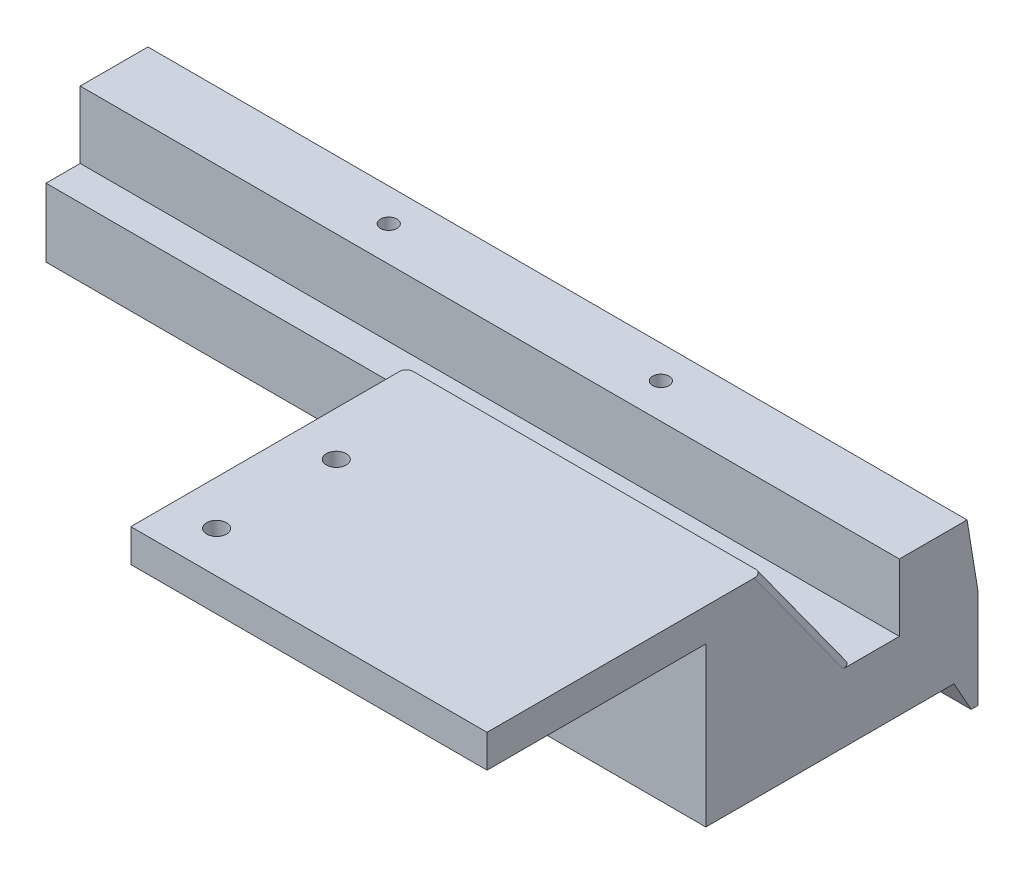
from build123d import *

# Parameters (mm, degrees)
SZKIC1_W                                             = 119.8
SZKIC1_H                                             = 10
DODANIE_WYCI_GNI_CIE2_DEPTH                          = 38.3
SZKIC21_W                                            = 119.8
SZKIC21_H                                            = 10
DODANIE_WYCI_GNI_CIE3_DEPTH                          = 9.8
POG_BIENIE_WALCOWE_POD_M2_WKR_T_DO_CZ_CI_D           = 2.4
POG_BIENIE_WALCOWE_POD_M2_WKR_T_DO_CZ_CI_CBORE_D     = 5
POG_BIENIE_WALCOWE_POD_M2_WKR_T_DO_CZ_CI_CBORE_DEPTH = 1.6
SZKIC28_R                                            = 11.1
WYTNIJ_WYCI_GNI_CIE1_DEPTH                           = 7.2
WYTNIJ_WYCI_GNI_CIE4_DEPTH                           = 124.8
DODANIE_WYCI_GNI_CIE5_DEPTH                          = 119.8
SZKIC34_W                                            = 119.8
SZKIC34_H                                            = 10
DODANIE_WYCI_GNI_CIE6_DEPTH                          = 1.5
SZKIC37_W                                            = 52.1
SZKIC37_H                                            = 8.3
DODANIE_WYCI_GNI_CIE8_DEPTH                          = 18
SZKIC38_W                                            = 52.1
SZKIC38_H                                            = 4.8
DODANIE_WYCI_GNI_CIE11_DEPTH                         = 32
ZAOKR_GLENIE5_R                                      = 0.5
SZYK_LINIOWY2_COUNT                                  = 2
SZYK_LINIOWY2_PITCH                                  = 24.2
ZAOKR_GLENIE5_OF_SZYK_LINIOWY2_R                     = 0.5
OTW_R_POD_RUB_M2_51_D                                = 2.9
EBRO7_REACH                                          = 149.637
SZKIC52_WALL_W                                       = 319.477141382
SZKIC52_WALL_H                                       = 3
ZAOKR_GLENIE7_R                                      = 1
SZYK_LINIOWY6_COUNT                                  = 5
SZYK_LINIOWY6_PITCH                                  = 12.25
ZAOKR_GLENIE7_OF_SZYK_LINIOWY6_R                     = 1
ZAOKR_GLENIE8_R                                      = 1
SZKIC53_W                                            = 67.7
SZKIC53_H                                            = 10
WYTNIJ_WYCI_GNI_CIE5_DEPTH                           = 23.3
DODANIE_WYCI_GNI_CIE12_DEPTH                         = 119.8
SZKIC55_R                                            = 5.1
WYTNIJ_WYCI_GNI_CIE6_DEPTH                           = 4.1


with BuildPart() as part:
    # Szkic1 → Dodanie-wyciągnięcie2 (new body)
    with BuildSketch(Plane.XY):
        with Locations((1.59336777, 27.024849398)):
            Rectangle(SZKIC1_W, SZKIC1_H)
    extrude(amount=DODANIE_WYCI_GNI_CIE2_DEPTH)

    # Szkic21 → Dodanie-wyciągnięcie3 (add)
    with BuildSketch(Plane(origin=(0, 32.024849398, 0), x_dir=(1, 0, 0), z_dir=(0, 1, 0))):
        with Locations((1.59336777, -5)):
            Rectangle(SZKIC21_W, SZKIC21_H)
    extrude(amount=DODANIE_WYCI_GNI_CIE3_DEPTH)

    # Pogłębienie walcowe pod M2 wkręt do części metalowych z łbem stożkowym ściętym2 (through all)
    with Locations(Plane(origin=(0, 22.024849398, 0), x_dir=(-1, 0, 0), z_dir=(0, -1, 0))):
        with Locations((-21.49336777, -4.88), (18.30663223, -4.88)):
            CounterBoreHole(POG_BIENIE_WALCOWE_POD_M2_WKR_T_DO_CZ_CI_D / 2, POG_BIENIE_WALCOWE_POD_M2_WKR_T_DO_CZ_CI_CBORE_D / 2, POG_BIENIE_WALCOWE_POD_M2_WKR_T_DO_CZ_CI_CBORE_DEPTH)

    # Szkic28 → Wytnij-wyciągnięcie1 (cut)
    with BuildSketch(Plane.XZ.offset(-22.024849398)):
        with Locations((36.49336777, 23.3)):
            Circle(SZKIC28_R)
    extrude(amount=-WYTNIJ_WYCI_GNI_CIE1_DEPTH, mode=Mode.SUBTRACT)

    # Szkic31 → Wytnij-wyciągnięcie4 (cut)
    with BuildSketch(Plane(origin=(61.49336777, 0, 0), x_dir=(0, 0, -1), z_dir=(1, 0, 0))):
        Polygon((0, 41.824849398), (-0.096491228, 41.824849398), (0, 41.232541705), align=None)
    extrude(amount=-WYTNIJ_WYCI_GNI_CIE4_DEPTH, mode=Mode.SUBTRACT)

    # Szkic31<5> → Dodanie-wyciągnięcie5 (add)
    with BuildSketch(Plane(origin=(61.49336777, 0, 0), x_dir=(0, 0, -1), z_dir=(1, 0, 0))):
        Polygon((0, 41.232541705), (0, 32.024849398), (1.5, 32.024849398), (0.275236278, 39.543014399), align=None)
    extrude(amount=-DODANIE_WYCI_GNI_CIE5_DEPTH)

    # Szkic34 → Dodanie-wyciągnięcie6 (add)
    with BuildSketch(Plane(origin=(0, 0, 0), x_dir=(-1, 0, 0), z_dir=(0, 0, -1))):
        with Locations((-1.59336777, 27.024849398)):
            Rectangle(SZKIC34_W, SZKIC34_H)
    extrude(amount=DODANIE_WYCI_GNI_CIE6_DEPTH)

    # Szkic37 → Dodanie-wyciągnięcie8 (add)
    with BuildSketch(Plane(origin=(0, 32.024849398, 0), x_dir=(1, 0, 0), z_dir=(0, 1, 0))):
        with Locations((35.44336777, -34.15)):
            Rectangle(SZKIC37_W, SZKIC37_H)
    extrude(amount=DODANIE_WYCI_GNI_CIE8_DEPTH)

    # Szkic38 → Dodanie-wyciągnięcie11 (add)
    with BuildSketch(Plane.XY.offset(38.3)):
        with Locations((35.44336777, 47.624849398)):
            Rectangle(SZKIC38_W, SZKIC38_H)
    extrude(amount=DODANIE_WYCI_GNI_CIE11_DEPTH)

    # Szkic40 → Wyciągnięcie po profilach5 section 0
    with BuildSketch(Plane.XZ.offset(-45.224849398)):
        with BuildLine():
            Line((39.018959326, 44.15), (44.018959326, 44.15))
            Line((44.018959326, 44.15), (44.018959326, 42.65))
            Line((44.018959326, 42.65), (39.018959326, 42.65))
            Line((39.018959326, 42.65), (39.018959326, 44.15))
        make_face()
    # Szkic41 → Wyciągnięcie po profilach5 section 1
    with BuildSketch(Plane(origin=(0, 43.224849398, 0), x_dir=(-1, 0, 0), z_dir=(0, -1, 0))):
        with BuildLine():
            Line((-43.490211754, -42.65), (-39.547706899, -42.65))
            Line((-39.547706899, -42.65), (-39.547706899, -44.15))
            Line((-39.547706899, -44.15), (-43.490211754, -44.15))
            Line((-43.490211754, -44.15), (-43.490211754, -42.65))
        make_face()
    wyci_gni_cie_po_profilach5 = loft()

    # Zaokrąglenie5
    zaokr_glenie5_edges = [part.edges().sort_by_distance(p)[0] for p in [
        (43.75458554, 44.224849398, 42.65),
        (43.75458554, 44.224849398, 44.15),
        (39.283333112, 44.224849398, 44.15),
        (39.283333112, 44.224849398, 42.65),
        (41.518959326, 43.224849398, 42.65),
        (41.518959326, 43.224849398, 44.15),
        (43.490211754, 43.224849398, 43.4),
        (39.547706899, 43.224849398, 43.4),
    ]]
    fillet(zaokr_glenie5_edges, radius=ZAOKR_GLENIE5_R)

    # Szyk liniowy2: Wyciągnięcie po profilach5 ×2
    with Locations(*[(0, 0, i * SZYK_LINIOWY2_PITCH) for i in range(1, SZYK_LINIOWY2_COUNT)]):
        add(wyci_gni_cie_po_profilach5)

    # Zaokrąglenie5 of Szyk liniowy2
    zaokr_glenie5_of_szyk_liniowy2_edges = [part.edges().sort_by_distance(p)[0] for p in [
        (43.75458554, 44.224849398, 66.85),
        (43.75458554, 44.224849398, 68.35),
        (39.283333112, 44.224849398, 68.35),
        (39.283333112, 44.224849398, 66.85),
        (41.518959326, 43.224849398, 66.85),
        (41.518959326, 43.224849398, 68.35),
        (43.490211754, 43.224849398, 67.6),
        (39.547706899, 43.224849398, 67.6),
    ]]
    fillet(zaokr_glenie5_of_szyk_liniowy2_edges, radius=ZAOKR_GLENIE5_OF_SZYK_LINIOWY2_R)

    # Otwór pod śrubę M2.51 (through all)
    with Locations(Plane(origin=(0, 45.224849398, 0), x_dir=(-1, 0, 0), z_dir=(0, -1, 0))):
        with Locations((-15.89336777, -46.75), (-15.89336777, -64.25)):
            Hole(OTW_R_POD_RUB_M2_51_D / 2)

    # Szkic52 wall → Żebro7 (add, up to next)
    with BuildSketch(Plane(origin=(61.49336777, 41.024849398, 23.5), x_dir=(0, -0.8106792284, -0.585490553844), z_dir=(0, 0.585490553844, -0.8106792284)), mode=Mode.PRIVATE) as ebro7_sk1:
        with Locations((0, 1.5)):
            Rectangle(SZKIC52_WALL_W, SZKIC52_WALL_H)
    ebro7_tool1 = extrude(ebro7_sk1.sketch, amount=-EBRO7_REACH, mode=Mode.PRIVATE) - part.part
    ebro7 = ebro7_tool1.solids().sort_by_distance((61.49336777, 41.024849398, 23.5))[0]
    add(ebro7)

    # Zaokrąglenie7
    zaokr_glenie7_edges = [part.edges().sort_by_distance(p)[0] for p in [
        (61.49336777, 41.024849398, 23.5),
        (58.49336777, 41.024849398, 23.5),
    ]]
    fillet(zaokr_glenie7_edges, radius=ZAOKR_GLENIE7_R)

    # Szyk liniowy6: Żebro7 ×5
    with Locations(*[(-i * SZYK_LINIOWY6_PITCH, 0, 0) for i in range(1, SZYK_LINIOWY6_COUNT)]):
        add(ebro7)

    # Zaokrąglenie7 of Szyk liniowy6
    zaokr_glenie7_of_szyk_liniowy6_edges = [part.edges().sort_by_distance(p)[0] for p in [
        (49.24336777, 41.024849398, 23.5),
        (46.24336777, 41.024849398, 23.5),
        (36.99336777, 41.024849398, 23.5),
        (33.99336777, 41.024849398, 23.5),
        (24.74336777, 41.024849398, 23.5),
        (21.74336777, 41.024849398, 23.5),
        (12.49336777, 41.024849398, 23.5),
        (9.49336777, 41.024849398, 23.5),
    ]]
    fillet(zaokr_glenie7_of_szyk_liniowy6_edges, radius=ZAOKR_GLENIE7_OF_SZYK_LINIOWY6_R)

    # Zaokrąglenie8
    zaokr_glenie8_edges = [part.edges().sort_by_distance(p)[0] for p in [
        (9.39336777, 41.024849398, 30),
    ]]
    fillet(zaokr_glenie8_edges, radius=ZAOKR_GLENIE8_R)

    # Szkic53 → Wytnij-wyciągnięcie5 (cut)
    with BuildSketch(Plane.XY.offset(38.3)):
        with Locations((-24.45663223, 27.024849398)):
            Rectangle(SZKIC53_W, SZKIC53_H)
    extrude(amount=-WYTNIJ_WYCI_GNI_CIE5_DEPTH, mode=Mode.SUBTRACT)

    # Szkic54 → Dodanie-wyciągnięcie12 (add)
    with BuildSketch(Plane(origin=(61.49336777, 0, 0), x_dir=(0, 0, -1), z_dir=(1, 0, 0))):
        Polygon((-2, 22.024849398), (1.5, 22.024849398), (1.5, 17.524849398), (0.5, 17.524849398), align=None)
    extrude(amount=-DODANIE_WYCI_GNI_CIE12_DEPTH)

    # Szkic55 → Wytnij-wyciągnięcie6 (cut)
    with BuildSketch(Plane.XZ.offset(-22.024849398)):
        with Locations((-45.80663223, 8.5)):
            Circle(SZKIC55_R)
        with Locations((-8.30663223, 8.5)):
            Circle(SZKIC55_R)
    extrude(amount=-WYTNIJ_WYCI_GNI_CIE6_DEPTH, mode=Mode.SUBTRACT)


solid = part.part
